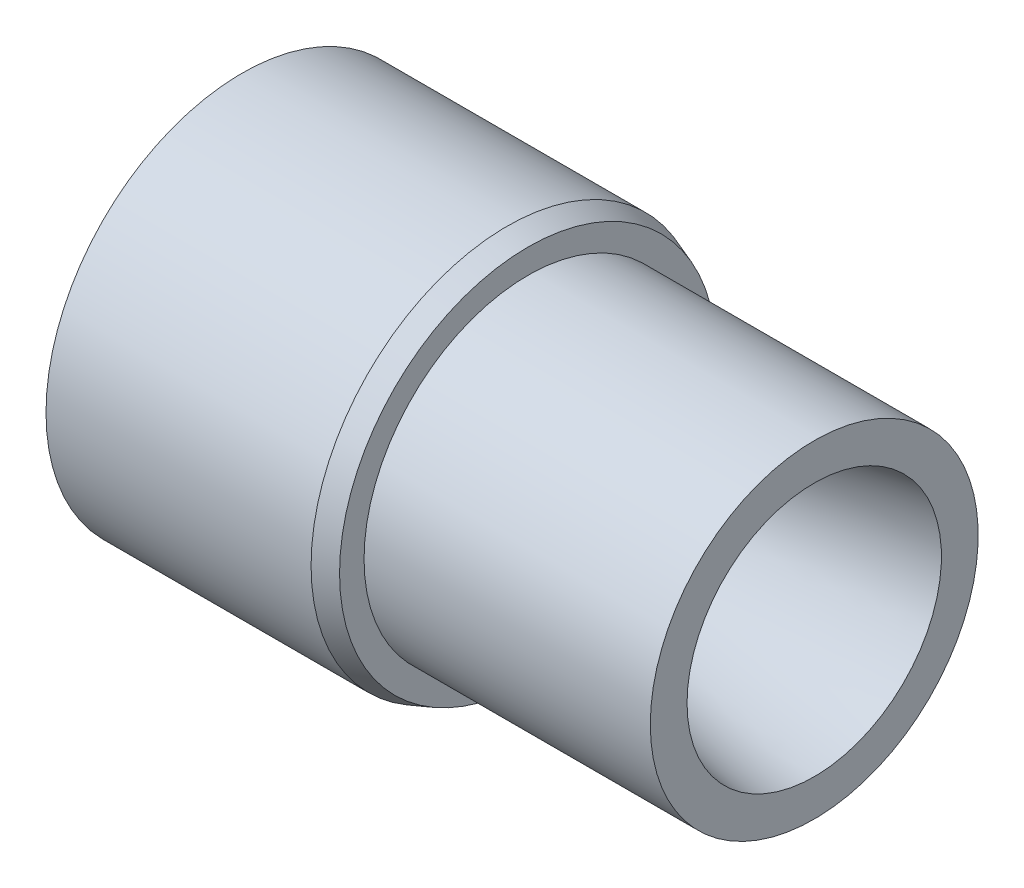
from build123d import *


with BuildPart() as part:
    # Sketch1 → Revolve1 (revolve)
    with BuildSketch(Plane.XY):
        with BuildLine():
            Line((42.945252988, 29.825549705), (62.812385376, 18.355255472))
            ThreePointArc((62.812385376, 18.355255472), (68.271514292, 16.084070702), (74.13, 15.285))
            ThreePointArc((74.13, 15.285), (75.042634026, 15.351014858), (75.933754417, 15.558772587))
            add(Edge.make_bspline(
                [(75.933754417, 15.558772587), (97.124186968, 22.913189408), (126.012294015, 29.837045564), (148.34, 32.975)],
                knots=[0, 0, 0, 0, 1, 1, 1, 1], degree=3))
            Line((148.34, 32.975), (148.34, 42.5))
            Line((148.34, 42.5), (74.13, 42.5))
            Line((74.13, 42.5), (74.13, 48.85))
            Line((74.13, 48.85), (68.717469484, 50.82))
            Line((68.717469484, 50.82), (0, 50.82))
            Line((0, 50.82), (0, 41.295))
            ThreePointArc((0, 41.295), (22.230006991, 38.396147211), (42.945252988, 29.825549705))
        make_face()
    revolve(axis=Axis((0, 0, 0), (1, 0, 0)))


solid = part.part
